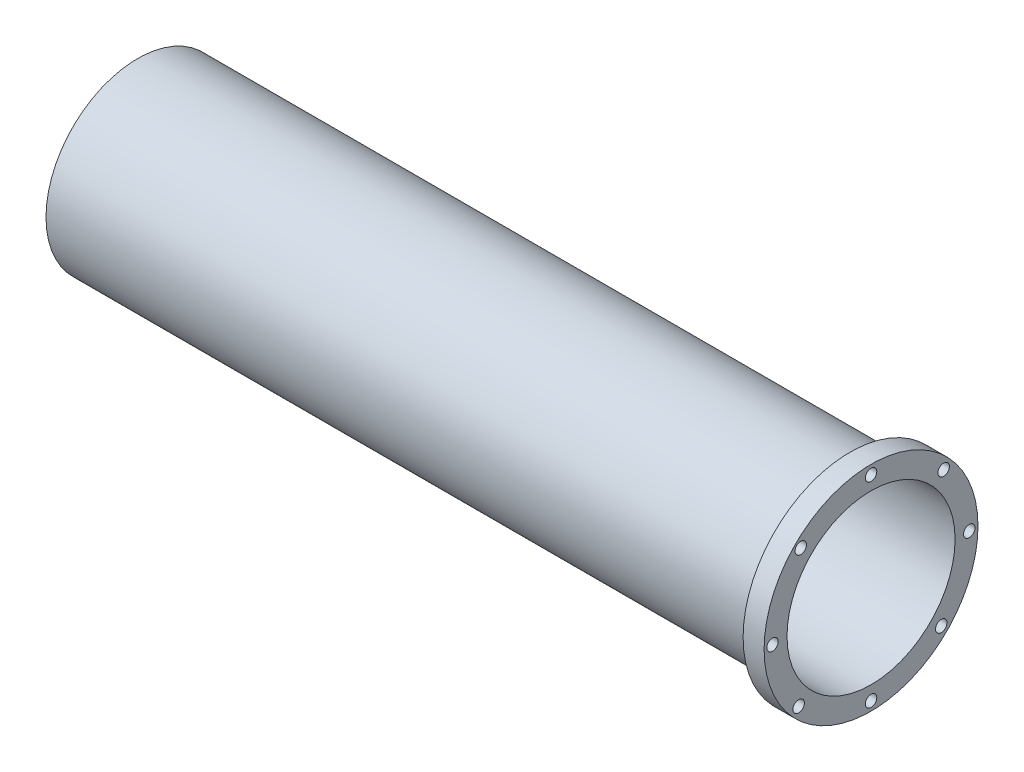
from build123d import *

# Parameters (mm, degrees)
ESBO_O5_R             = 1.5
CORTE_EXTRUS_O5_DEPTH = 5


with BuildPart() as part:
    # Esboço4 → Revolução2 (revolve)
    with BuildSketch(Plane(origin=(0, 0, 0), x_dir=(1, 0, 0), z_dir=(0, 1, 0))):
        with BuildLine():
            Line((-186.5, 60.748812336), (-186.5, 62.748812336))
            Line((-186.5, 62.748812336), (0, 62.748812336))
            Line((0, 62.748812336), (0, 66.748812336))
            Line((0, 66.748812336), (5.5, 66.748812336))
            Line((5.5, 66.748812336), (5.5, 60.748812336))
            Line((5.5, 60.748812336), (-181.682334081, 60.748812336))
            ThreePointArc((-181.682334081, 60.748812336), (-182.962896447, 60.271650475), (-183.5, 59.015050622))
            Line((-183.5, 59.015050622), (-183.5, 38.748812336))
            Line((-183.5, 38.748812336), (-186.5, 38.748812336))
            Line((-186.5, 38.748812336), (-186.5, 60.748812336))
        make_face()
    revolve(axis=Axis((-185, 0, -38.748812336), (1, 0, 0)))

    # Esboço5 → Corte-extrusão5 (cut)
    with BuildSketch(Plane(origin=(5.5, 0, 0), x_dir=(0, 0, -1), z_dir=(1, 0, 0))):
        with Locations((20.342492018, 18.226873469)):
            Circle(ESBO_O5_R)
        with Locations((38.748812336, 25.594065775)):
            Circle(ESBO_O5_R)
        with Locations((57.755172546, 17.263414885)):
            Circle(ESBO_O5_R)
        with Locations((64.468431294, 0)):
            Circle(ESBO_O5_R)
        with Locations((57.124728507, -17.848094555)):
            Circle(ESBO_O5_R)
        with Locations((38.748812336, -25.638098051)):
            Circle(ESBO_O5_R)
        with Locations((19.794839239, -17.398827469)):
            Circle(ESBO_O5_R)
        with Locations((12.947826994, 0)):
            Circle(ESBO_O5_R)
    extrude(amount=-CORTE_EXTRUS_O5_DEPTH, mode=Mode.SUBTRACT)


solid = part.part
